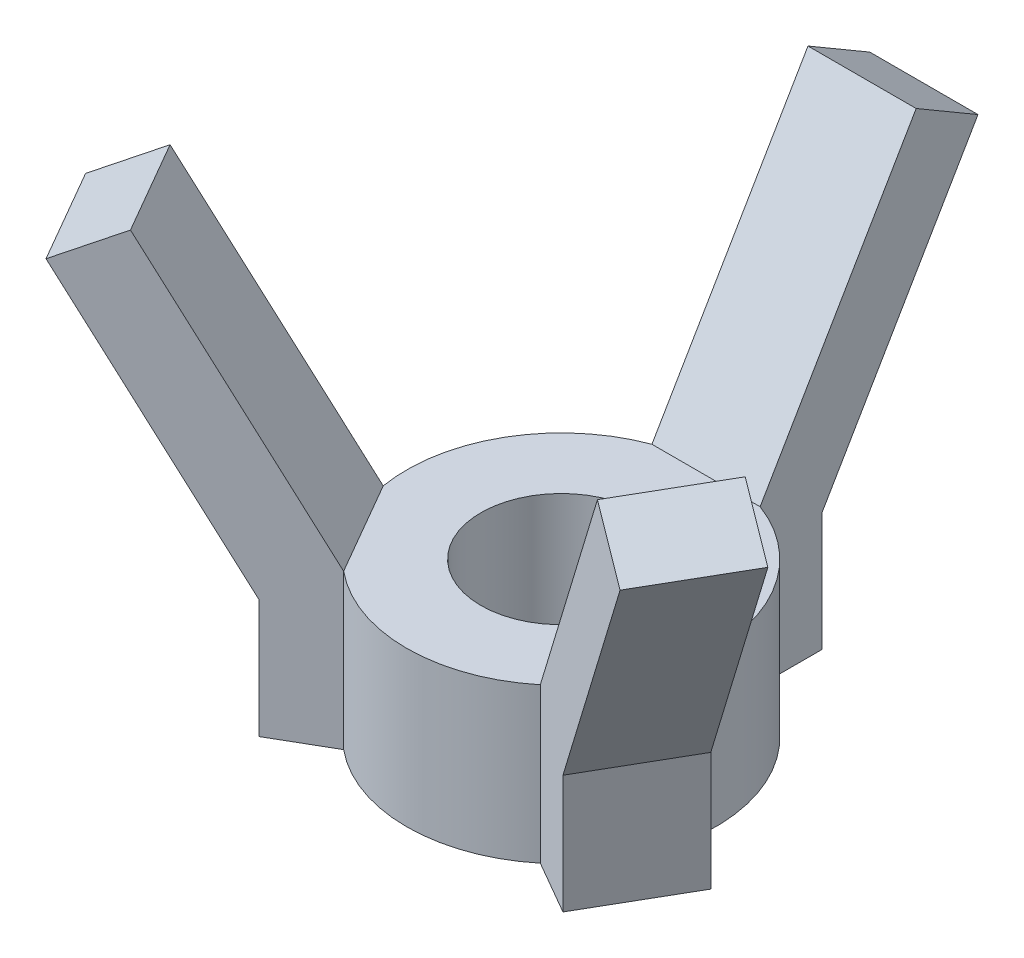
from build123d import *

# Parameters (mm, degrees)
SKETCH_1_R               = 2.6
EXTRUDE_1_DEPTH          = 5
EXTRUDE_2_DEPTH          = 3.5
PATTERN_CIRCULAR_4_COUNT = 3


with BuildPart() as part:
    # 草图1 → 凸台-拉伸1 (new body)
    with BuildSketch(Plane(origin=(0, 0, 0), x_dir=(1, 0, 0), z_dir=(0, 1, 0))):
        with BuildLine():
            Line((-4.913295992, -4.857418706), (-3.181245185, -3.857418706))
            ThreePointArc((-3.181245185, -3.857418706), (0, -5), (3.181245185, -3.857418706))
            Line((3.181245185, -3.857418706), (4.913295992, -4.857418706))
            Line((4.913295992, -4.857418706), (6.663295992, -1.826329793))
            Line((6.663295992, -1.826329793), (4.931245185, -0.826329793))
            ThreePointArc((4.931245185, -0.826329793), (4.330127019, 2.5), (1.75, 4.683748499))
            Line((1.75, 4.683748499), (1.75, 6.683748499))
            Line((1.75, 6.683748499), (-1.75, 6.683748499))
            Line((-1.75, 6.683748499), (-1.75, 4.683748499))
            ThreePointArc((-1.75, 4.683748499), (-4.330127019, 2.5), (-4.931245185, -0.826329793))
            Line((-4.931245185, -0.826329793), (-6.663295992, -1.826329793))
            Line((-6.663295992, -1.826329793), (-4.913295992, -4.857418706))
        make_face()
        with Locations(Location((0, 0, 0), (0, 0, 270))):
            Circle(SKETCH_1_R, mode=Mode.SUBTRACT)
    extrude(amount=EXTRUDE_1_DEPTH)

    # 草图2 → 凸台-拉伸2 (add)
    with BuildSketch(Plane(origin=(0.875, 0, 1.515544457), x_dir=(0.8660254037844383, 0, -0.5000000000000009), z_dir=(0.5000000000000008, 0, 0.8660254037844382))):
        Polygon((-4.683748499, 5), (-9.731723247, 13.632378058), (-11.731723247, 12.462833649), (-6.683748499, 3.830455591), align=None)
    extrude(amount=-EXTRUDE_2_DEPTH)


with BuildPart() as pattern_circular_4_1:
    # 阵列(圆周)4: pattern copy
    add(part.part.rotate(Axis((0, 0, 0), (0, 1, 0)), 1 * 360 / PATTERN_CIRCULAR_4_COUNT))


with BuildPart() as pattern_circular_4_2:
    # 阵列(圆周)4: pattern copy
    add(part.part.rotate(Axis((0, 0, 0), (0, 1, 0)), 2 * 360 / PATTERN_CIRCULAR_4_COUNT))


with BuildPart() as pattern_circular_4_1_1:
    add(pattern_circular_4_1.part)

    # Combine 1: read off the stored shape, not the designer's step
    # Combine 1: union 阵列(圆周)4_2, part
    add(pattern_circular_4_2.part)
    add(part.part)


solid = pattern_circular_4_1_1.part
